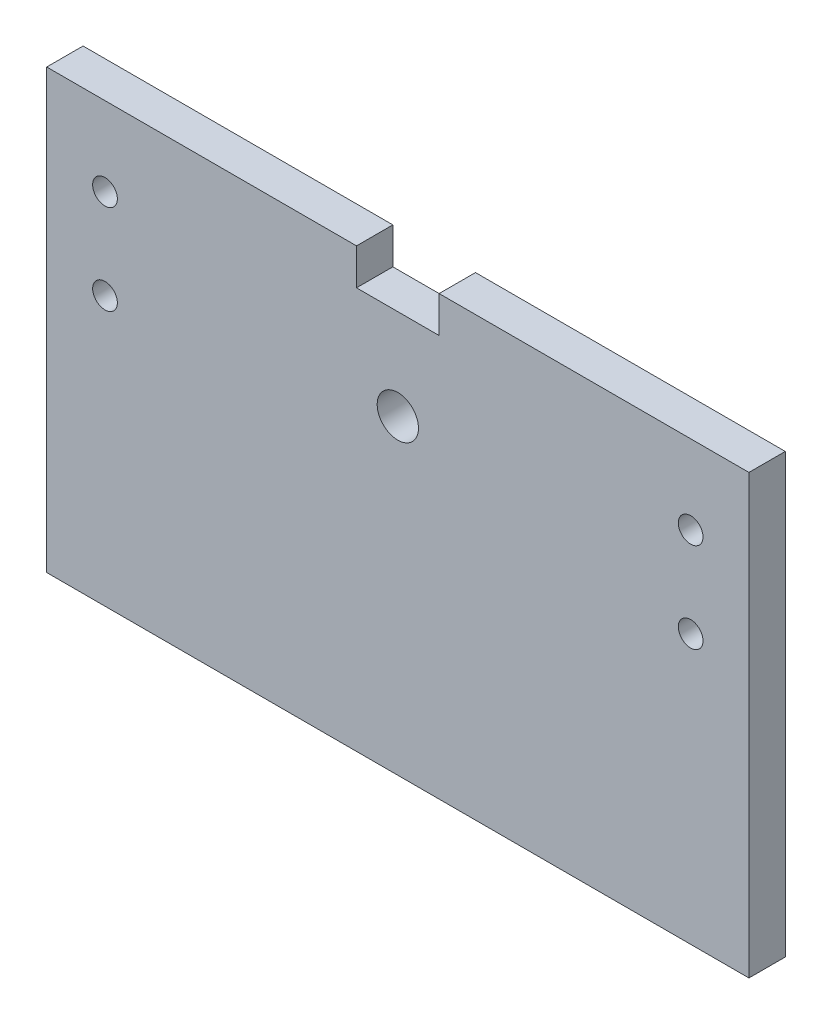
from build123d import *

# Parameters (mm, degrees)
BOSS_EXTRUDE1_DEPTH   = 2.794
F_6_CLEARANCE_HOLE1_D = 3.7973
CUT_EXTRUDE1_REACH    = 65.853
SKETCH5_R             = 3.175


with BuildPart() as part:
    # Sketch1 → Boss-Extrude1 (new, symmetric)
    with BuildSketch(Plane.XY):
        Polygon((-6.35, 33.655), (-6.35, 28.067), (6.35, 28.067), (6.35, 33.655), (53.975, 33.655), (53.975, -33.655), (-53.975, -33.655), (-53.975, 33.655), align=None)
    extrude(amount=BOSS_EXTRUDE1_DEPTH, both=True)

    # #6 Clearance Hole1 (through all)
    with Locations(Plane(origin=(0, 0, -2.794), x_dir=(-1, 0, 0), z_dir=(0, 0, -1))):
        with Locations((-45.014797213, 21.519797213), (-45.014797213, 7.690202787), (45.014797213, 21.519797213), (45.014797213, 7.690202787)):
            Hole(F_6_CLEARANCE_HOLE1_D / 2)

    # Sketch5 → Cut-Extrude1 (cut, up to next)
    with BuildSketch(Plane(origin=(0, 0, -2.794), x_dir=(-1, 0, 0), z_dir=(0, 0, -1)), mode=Mode.PRIVATE) as cut_extrude1_sk1:
        with Locations((0, 14.134539551)):
            Circle(SKETCH5_R)
    cut_extrude1_tool1 = extrude(cut_extrude1_sk1.sketch, amount=-CUT_EXTRUDE1_REACH, mode=Mode.PRIVATE) & part.part
    add(cut_extrude1_tool1.solids().sort_by_distance((0, 14.13454, -2.794))[0], mode=Mode.SUBTRACT)


solid = part.part
